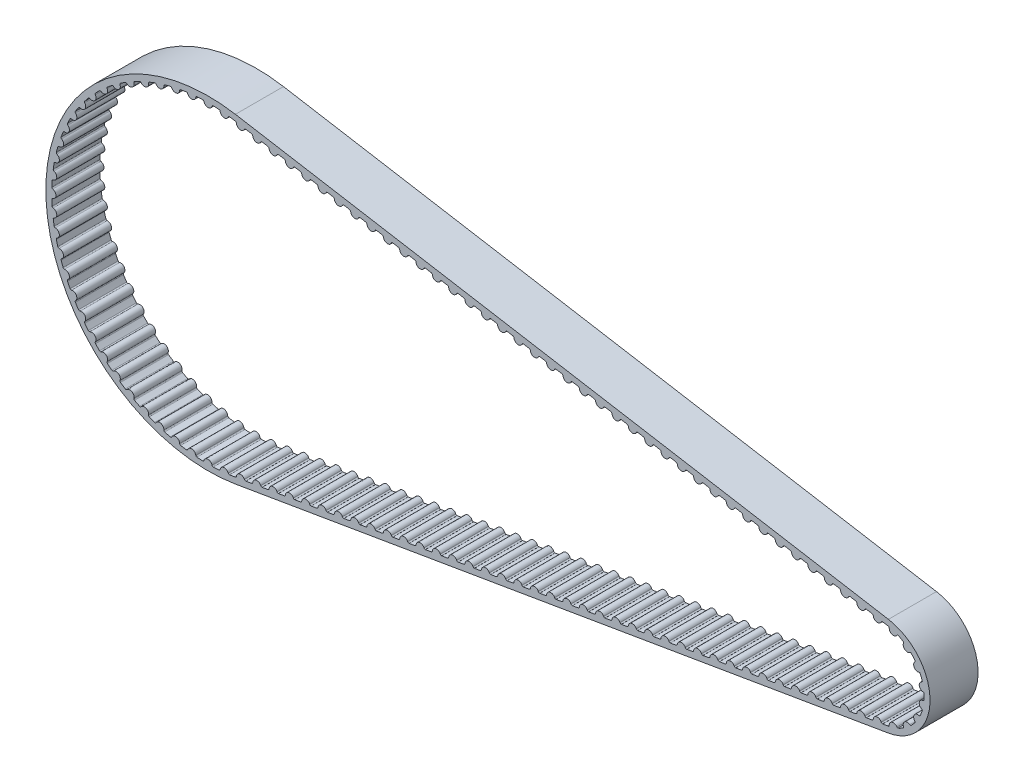
from build123d import *

# Parameters (mm, degrees)
BOSS_EXTRUDE1_DEPTH = 5
BOSS_EXTRUDE2_DEPTH = 10
CRVPATTERN1_START   = -5
CRVPATTERN1_DEPTH   = 10


with BuildPart() as part:
    # Sketch1 → Boss-Extrude1 (new, symmetric)
    with BuildSketch(Plane.XY):
        with BuildLine():
            Line((5.655497773, 33.317483845), (141.540173278, 10.251652005))
            ThreePointArc((141.540173278, 10.251652005), (150.198296585, 0), (141.540173278, -10.251652005))
            Line((141.540173278, -10.251652005), (5.655497773, -33.317483845))
            ThreePointArc((5.655497773, -33.317483845), (-33.79407322, 0), (5.655497773, 33.317483845))
        make_face()
        with BuildLine():
            Line((5.449655103, 32.104830228), (141.334330608, 9.038998388))
            ThreePointArc((141.334330608, 9.038998388), (148.968296585, 0), (141.334330608, -9.038998388))
            Line((141.334330608, -9.038998388), (5.449655103, -32.104830228))
            ThreePointArc((5.449655103, -32.104830228), (-32.56407322, 0), (5.449655103, 32.104830228))
        make_face(mode=Mode.SUBTRACT)
    extrude(amount=BOSS_EXTRUDE1_DEPTH, both=True)

    # Sketch2 → Boss-Extrude2 (add)
    with BuildSketch(Plane.XY.offset(5)):
        with BuildLine():
            Line((-32.545355766, -1.103939642), (-33.045355766, -1.103939642))
            Line((-33.045355766, -1.103939642), (-33.045355766, 1.103939642))
            Line((-33.045355766, 1.103939642), (-32.545355766, 1.103939642))
            ThreePointArc((-32.545355766, 1.103939642), (-32.493442879, 0.939042427), (-32.349600505, 0.843149723))
            ThreePointArc((-32.349600505, 0.843149723), (-31.69407322, 0), (-32.349600505, -0.843149723))
            ThreePointArc((-32.349600505, -0.843149723), (-32.493442879, -0.939042427), (-32.545355766, -1.103939642))
        make_face()
    extrude(amount=-BOSS_EXTRUDE2_DEPTH)

    # CrvPattern1: read off the stored shape, not the designer's step
    # CrvPattern1 outline → CrvPattern1 (add)
    with BuildSketch(Plane.XY.offset(CRVPATTERN1_START)):
        with BuildLine():
            ThreePointArc((-32.084703076, 4.216560542), (-32.217745732, 4.326949359), (-32.252155864, 4.496365953))
            ThreePointArc((-32.252155864, 4.496365953), (-32.386046927, 3.400416018), (-32.482707737, 2.300557044))
            ThreePointArc((-32.482707737, 2.300557044), (-32.413859707, 2.459131909), (-32.260790374, 2.539480018))
            ThreePointArc((-32.260790374, 2.539480018), (-31.520803177, 3.309568601), (-32.084703076, 4.216560542))
        make_face()
        with BuildLine():
            ThreePointArc((-31.468994451, 7.543867875), (-31.589782713, 7.667545824), (-31.606313853, 7.839629411))
            ThreePointArc((-31.606313853, 7.839629411), (-31.853914572, 6.7636522), (-32.064896766, 5.67989965))
            ThreePointArc((-32.064896766, 5.67989965), (-31.97986637, 5.830418323), (-31.819243724, 5.894343318))
            ThreePointArc((-31.819243724, 5.894343318), (-31.002887568, 6.582950683), (-31.468994451, 7.543867875))
        make_face()
        with BuildLine():
            ThreePointArc((-30.509206732, 10.788691251), (-30.616419911, 10.924306049), (-30.614891309, 11.097175082))
            ThreePointArc((-30.614891309, 11.097175082), (-30.973494442, 10.05293523), (-31.296491159, 8.997138755))
            ThreePointArc((-31.296491159, 8.997138755), (-31.196208111, 9.137955478), (-31.029788386, 9.184758409))
            ThreePointArc((-31.029788386, 9.184758409), (-30.145989235, 9.784355388), (-30.509206732, 10.788691251))
        make_face()
        with BuildLine():
            ThreePointArc((-29.215834148, 13.915552067), (-29.308299987, 14.061620914), (-29.288728356, 14.23338526))
            ThreePointArc((-29.288728356, 14.23338526), (-29.754412968, 13.232300389), (-30.185892593, 12.216003971))
            ThreePointArc((-30.185892593, 12.216003971), (-30.071453379, 12.345579067), (-29.901056192, 12.374748196))
            ThreePointArc((-29.901056192, 12.374748196), (-28.959477424, 12.878778849), (-29.215834148, 13.915552067))
        make_face()
        with BuildLine():
            ThreePointArc((-27.603018318, 16.890261515), (-27.679725802, 17.045187308), (-27.642325138, 17.213968911))
            ThreePointArc((-27.642325138, 17.213968911), (-28.209999476, 16.266984792), (-28.74524425, 15.301300522))
            ThreePointArc((-28.74524425, 15.301300522), (-28.617900138, 15.418217229), (-28.445388597, 15.429433622))
            ThreePointArc((-28.445388597, 15.429433622), (-27.456325347, 15.832386925), (-27.603018318, 16.890261515))
        make_face()
        with BuildLine():
            ThreePointArc((-25.688393621, 19.680294395), (-25.748504038, 19.842383189), (-25.693683275, 20.006336607))
            ThreePointArc((-25.693683275, 20.006336607), (-26.357140441, 19.123807477), (-26.990298047, 18.219294059))
            ThreePointArc((-26.990298047, 18.219294059), (-26.851441405, 18.32227402), (-26.678701735, 18.315415039))
            ThreePointArc((-26.678701735, 18.315415039), (-25.652968331, 18.612885137), (-25.688393621, 19.680294395))
        make_face()
        with BuildLine():
            ThreePointArc((-23.492894388, 22.255144744), (-23.535750497, 22.422624275), (-23.46410904, 22.579956856))
            ThreePointArc((-23.46410904, 22.579956856), (-24.216094854, 21.771532208), (-24.940242404, 20.938079508))
            ThreePointArc((-24.940242404, 20.938079508), (-24.791391479, 21.025996751), (-24.620312399, 21.00113739))
            ThreePointArc((-24.620312399, 21.00113739), (-23.569124115, 21.189871772), (-23.492894388, 22.255144744))
        make_face()
        with BuildLine():
            ThreePointArc((-21.040526006, 24.586659385), (-21.065659221, 24.757698447), (-20.977980393, 24.906689931))
            ThreePointArc((-20.977980393, 24.906689931), (-21.81027271, 24.181209005), (-22.617492442, 23.427929919))
            ThreePointArc((-22.617492442, 23.427929919), (-22.460274756, 23.499823164), (-22.29272683, 23.457235233))
            ThreePointArc((-22.29272683, 23.457235233), (-21.227577262, 23.535170296), (-21.040526006, 24.586659385))
        make_face()
        with BuildLine():
            ThreePointArc((-18.358102445, 26.649345751), (-18.365237963, 26.822074219), (-18.262480434, 26.961095547))
            ThreePointArc((-18.262480434, 26.961095547), (-19.165979048, 26.326490685), (-20.047444895, 25.661621497))
            ThreePointArc((-20.047444895, 25.661621497), (-19.883579452, 25.716704669), (-19.721394633, 25.656853822))
            ThreePointArc((-19.721394633, 25.656853822), (-18.653930028, 25.62313743), (-18.358102445, 26.649345751))
        make_face()
        with BuildLine():
            ThreePointArc((-15.474953078, 28.420650618), (-15.464012879, 28.593179895), (-15.347300192, 28.72071102))
            ThreePointArc((-15.347300192, 28.72071102), (-16.312126331, 28.183920934), (-17.258200427, 27.614731262))
            ThreePointArc((-17.258200427, 27.614731262), (-17.089478916, 27.652402087), (-16.934430518, 27.575942728))
            ThreePointArc((-16.934430518, 27.575942728), (-15.876322438, 27.430943533), (-15.474953078, 28.420650618))
        make_face()
        with BuildLine():
            ThreePointArc((-12.422601996, 29.881206702), (-12.3937057, 30.051650368), (-12.26431398, 30.166296877))
            ThreePointArc((-12.26431398, 30.166296877), (-13.279918324, 29.73319078), (-14.280256381, 29.265904093))
            ThreePointArc((-14.280256381, 29.265904093), (-14.108523588, 29.285750682), (-13.962306896, 29.193518809))
            ThreePointArc((-13.962306896, 29.193518809), (-12.925124596, 28.93882222), (-12.422601996, 29.881206702))
        make_face()
        with BuildLine():
            ThreePointArc((-9.234423325, 31.015044417), (-9.187886881, 31.181538857), (-9.047230885, 31.282047216))
            ThreePointArc((-9.047230885, 31.282047216), (-10.10250891, 30.95736065), (-11.146173323, 30.597086216))
            ThreePointArc((-11.146173323, 30.597086216), (-10.973306959, 30.598891568), (-10.837520693, 30.491895637))
            ThreePointArc((-10.837520693, 30.491895637), (-9.832604629, 30.130286482), (-9.234423325, 31.015044417))
        make_face()
        with BuildLine():
            ThreePointArc((-5.945276317, 31.809766485), (-5.88160855, 31.970491264), (-5.731226198, 32.055762523))
            ThreePointArc((-5.731226198, 32.055762523), (-6.814639591, 31.843045582), (-7.890219031, 31.593722609))
            ThreePointArc((-7.890219031, 31.593722609), (-7.7181092, 31.577466985), (-7.594238034, 31.456876879))
            ThreePointArc((-7.594238034, 31.456876879), (-6.632575866, 30.99230896), (-5.945276317, 31.809766485))
        make_face()
        with BuildLine():
            ThreePointArc((-2.591124204, 32.256683488), (-2.511021252, 32.409881257), (-2.352556811, 32.478983068))
            ThreePointArc((-2.352556811, 32.478983068), (-3.452259629, 32.380561579), (-4.547993808, 32.244916142))
            ThreePointArc((-4.547993808, 32.244916142), (-4.378522343, 32.210777279), (-4.267920674, 32.077911519))
            ThreePointArc((-4.267920674, 32.077911519), (-3.360027129, 31.515464378), (-2.591124204, 32.256683488))
        make_face()
        with BuildLine():
            ThreePointArc((0.791359022, 32.350908878), (0.887021322, 32.494904585), (1.051835216, 32.547081395))
            ThreePointArc((1.051835216, 32.547081395), (-0.052132976, 32.564031489), (-1.156041238, 32.543546724))
            ThreePointArc((-1.156041238, 32.543546724), (-0.991061125, 32.491897893), (-0.894938262, 32.348209221))
            ThreePointArc((-0.894938262, 32.348209221), (-0.050740163, 31.694032604), (0.791359022, 32.350908878))
        make_face()
        with BuildLine():
            ThreePointArc((4.165189602, 32.091412401), (4.275365286, 32.224631612), (4.444726574, 32.259312925))
            ThreePointArc((4.444726574, 32.259312925), (3.348563693, 32.391449271), (2.24855138, 32.486349155))
            ThreePointArc((2.24855138, 32.486349155), (2.407236264, 32.41775508), (2.487829324, 32.264814575))
            ThreePointArc((2.487829324, 32.264814575), (3.259101591, 31.526061189), (4.165189602, 32.091412401))
        make_face()
        with BuildLine():
            Line((7.817293022, 31.683948805), (7.820425421, 31.702402292))
            Line((7.820425421, 31.702402292), (5.643683307, 32.071894785))
            Line((5.643683307, 32.071894785), (5.640550908, 32.053441299))
            ThreePointArc((5.640550908, 32.053441299), (5.794434906, 31.974664686), (5.864902984, 31.816803072))
            ThreePointArc((5.864902984, 31.816803072), (6.586458329, 31.029417931), (7.527420969, 31.534597885))
            ThreePointArc((7.527420969, 31.534597885), (7.646033598, 31.660363873), (7.817293022, 31.683948805))
        make_face()
        with BuildLine():
            Line((11.215171924, 31.107173661), (11.218304323, 31.125627147))
            Line((11.218304323, 31.125627147), (9.04156221, 31.495119641))
            Line((9.04156221, 31.495119641), (9.038429811, 31.476666154))
            ThreePointArc((9.038429811, 31.476666154), (9.192313809, 31.397889541), (9.262781887, 31.240027927))
            ThreePointArc((9.262781887, 31.240027927), (9.984337232, 30.452642786), (10.925299872, 30.95782274))
            ThreePointArc((10.925299872, 30.95782274), (11.0439125, 31.083588728), (11.215171924, 31.107173661))
        make_face()
        with BuildLine():
            Line((14.613050827, 30.530398516), (14.616183226, 30.548852002))
            Line((14.616183226, 30.548852002), (12.439441112, 30.918344496))
            Line((12.439441112, 30.918344496), (12.436308713, 30.899891009))
            ThreePointArc((12.436308713, 30.899891009), (12.590192711, 30.821114397), (12.660660789, 30.663252783))
            ThreePointArc((12.660660789, 30.663252783), (13.382216134, 29.875867642), (14.323178775, 30.381047596))
            ThreePointArc((14.323178775, 30.381047596), (14.441791403, 30.506813583), (14.613050827, 30.530398516))
        make_face()
        with BuildLine():
            Line((18.01092973, 29.953623371), (18.014062129, 29.972076858))
            Line((18.014062129, 29.972076858), (15.837320015, 30.341569351))
            Line((15.837320015, 30.341569351), (15.834187616, 30.323115865))
            ThreePointArc((15.834187616, 30.323115865), (15.988071613, 30.244339252), (16.058539692, 30.086477638))
            ThreePointArc((16.058539692, 30.086477638), (16.780095037, 29.299092497), (17.721057677, 29.804272451))
            ThreePointArc((17.721057677, 29.804272451), (17.839670306, 29.930038439), (18.01092973, 29.953623371))
        make_face()
        with BuildLine():
            Line((21.408808632, 29.376848227), (21.411941031, 29.395301713))
            Line((21.411941031, 29.395301713), (19.235198917, 29.764794207))
            Line((19.235198917, 29.764794207), (19.232066519, 29.74634072))
            ThreePointArc((19.232066519, 29.74634072), (19.385950516, 29.667564107), (19.456418595, 29.509702493))
            ThreePointArc((19.456418595, 29.509702493), (20.17797394, 28.722317352), (21.11893658, 29.227497306))
            ThreePointArc((21.11893658, 29.227497306), (21.237549208, 29.353263294), (21.408808632, 29.376848227))
        make_face()
        with BuildLine():
            Line((24.806687535, 28.800073082), (24.809819934, 28.818526568))
            Line((24.809819934, 28.818526568), (22.63307782, 29.188019062))
            Line((22.63307782, 29.188019062), (22.629945421, 29.169565575))
            ThreePointArc((22.629945421, 29.169565575), (22.783829419, 29.090788963), (22.854297497, 28.932927349))
            ThreePointArc((22.854297497, 28.932927349), (23.575852842, 28.145542207), (24.516815482, 28.650722162))
            ThreePointArc((24.516815482, 28.650722162), (24.635428111, 28.776488149), (24.806687535, 28.800073082))
        make_face()
        with BuildLine():
            Line((28.204566437, 28.223297937), (28.207698836, 28.241751423))
            Line((28.207698836, 28.241751423), (26.030956723, 28.611243917))
            Line((26.030956723, 28.611243917), (26.027824324, 28.59279043))
            ThreePointArc((26.027824324, 28.59279043), (26.181708321, 28.514013818), (26.2521764, 28.356152204))
            ThreePointArc((26.2521764, 28.356152204), (26.973731745, 27.568767063), (27.914694385, 28.073947017))
            ThreePointArc((27.914694385, 28.073947017), (28.033307013, 28.199713004), (28.204566437, 28.223297937))
        make_face()
        with BuildLine():
            Line((31.60244534, 27.646522792), (31.605577739, 27.664976279))
            Line((31.605577739, 27.664976279), (29.428835625, 28.034468772))
            Line((29.428835625, 28.034468772), (29.425703226, 28.016015286))
            ThreePointArc((29.425703226, 28.016015286), (29.579587224, 27.937238673), (29.650055302, 27.779377059))
            ThreePointArc((29.650055302, 27.779377059), (30.371610647, 26.991991918), (31.312573287, 27.497171872))
            ThreePointArc((31.312573287, 27.497171872), (31.431185916, 27.62293786), (31.60244534, 27.646522792))
        make_face()
        with BuildLine():
            Line((35.000324242, 27.069747648), (35.003456641, 27.088201134))
            Line((35.003456641, 27.088201134), (32.826714528, 27.457693628))
            Line((32.826714528, 27.457693628), (32.823582129, 27.439240141))
            ThreePointArc((32.823582129, 27.439240141), (32.977466126, 27.360463529), (33.047934205, 27.202601915))
            ThreePointArc((33.047934205, 27.202601915), (33.769489549, 26.415216773), (34.71045219, 26.920396727))
            ThreePointArc((34.71045219, 26.920396727), (34.829064818, 27.046162715), (35.000324242, 27.069747648))
        make_face()
        with BuildLine():
            Line((38.398203145, 26.492972503), (38.401335544, 26.511425989))
            Line((38.401335544, 26.511425989), (36.22459343, 26.880918483))
            Line((36.22459343, 26.880918483), (36.221461031, 26.862464996))
            ThreePointArc((36.221461031, 26.862464996), (36.375345029, 26.783688384), (36.445813107, 26.62582677))
            ThreePointArc((36.445813107, 26.62582677), (37.167368452, 25.838441629), (38.108331093, 26.343621583))
            ThreePointArc((38.108331093, 26.343621583), (38.226943721, 26.46938757), (38.398203145, 26.492972503))
        make_face()
        with BuildLine():
            Line((41.796082048, 25.916197358), (41.799214447, 25.934650845))
            Line((41.799214447, 25.934650845), (39.622472333, 26.304143338))
            Line((39.622472333, 26.304143338), (39.619339934, 26.285689852))
            ThreePointArc((39.619339934, 26.285689852), (39.773223931, 26.206913239), (39.84369201, 26.049051625))
            ThreePointArc((39.84369201, 26.049051625), (40.565247355, 25.261666484), (41.506209995, 25.766846438))
            ThreePointArc((41.506209995, 25.766846438), (41.624822624, 25.892612426), (41.796082048, 25.916197358))
        make_face()
        with BuildLine():
            Line((45.19396095, 25.339422214), (45.197093349, 25.3578757))
            Line((45.197093349, 25.3578757), (43.020351236, 25.727368193))
            Line((43.020351236, 25.727368193), (43.017218837, 25.708914707))
            ThreePointArc((43.017218837, 25.708914707), (43.171102835, 25.630138094), (43.241570913, 25.47227648))
            ThreePointArc((43.241570913, 25.47227648), (43.963126258, 24.684891339), (44.904088898, 25.190071293))
            ThreePointArc((44.904088898, 25.190071293), (45.022701526, 25.315837281), (45.19396095, 25.339422214))
        make_face()
        with BuildLine():
            Line((48.591839853, 24.762647069), (48.594972252, 24.781100555))
            Line((48.594972252, 24.781100555), (46.418230138, 25.150593049))
            Line((46.418230138, 25.150593049), (46.415097739, 25.132139562))
            ThreePointArc((46.415097739, 25.132139562), (46.568981737, 25.05336295), (46.639449815, 24.895501336))
            ThreePointArc((46.639449815, 24.895501336), (47.36100516, 24.108116194), (48.3019678, 24.613296149))
            ThreePointArc((48.3019678, 24.613296149), (48.420580429, 24.739062136), (48.591839853, 24.762647069))
        make_face()
        with BuildLine():
            Line((51.989718755, 24.185871924), (51.992851154, 24.20432541))
            Line((51.992851154, 24.20432541), (49.816109041, 24.573817904))
            Line((49.816109041, 24.573817904), (49.812976642, 24.555364417))
            ThreePointArc((49.812976642, 24.555364417), (49.966860639, 24.476587805), (50.037328718, 24.318726191))
            ThreePointArc((50.037328718, 24.318726191), (50.758884063, 23.53134105), (51.699846703, 24.036521004))
            ThreePointArc((51.699846703, 24.036521004), (51.818459331, 24.162286991), (51.989718755, 24.185871924))
        make_face()
        with BuildLine():
            Line((55.387597658, 23.609096779), (55.390730057, 23.627550266))
            Line((55.390730057, 23.627550266), (53.213987943, 23.997042759))
            Line((53.213987943, 23.997042759), (53.210855544, 23.978589273))
            ThreePointArc((53.210855544, 23.978589273), (53.364739542, 23.89981266), (53.43520762, 23.741951046))
            ThreePointArc((53.43520762, 23.741951046), (54.156762965, 22.954565905), (55.097725605, 23.459745859))
            ThreePointArc((55.097725605, 23.459745859), (55.216338234, 23.585511847), (55.387597658, 23.609096779))
        make_face()
        with BuildLine():
            Line((58.785476561, 23.032321635), (58.788608959, 23.050775121))
            Line((58.788608959, 23.050775121), (56.611866846, 23.420267615))
            Line((56.611866846, 23.420267615), (56.608734447, 23.401814128))
            ThreePointArc((56.608734447, 23.401814128), (56.762618444, 23.323037516), (56.833086523, 23.165175902))
            ThreePointArc((56.833086523, 23.165175902), (57.554641867, 22.37779076), (58.495604508, 22.882970714))
            ThreePointArc((58.495604508, 22.882970714), (58.614217137, 23.008736702), (58.785476561, 23.032321635))
        make_face()
        with BuildLine():
            Line((62.183355463, 22.45554649), (62.186487862, 22.473999976))
            Line((62.186487862, 22.473999976), (60.009745748, 22.84349247))
            Line((60.009745748, 22.84349247), (60.006613349, 22.825038983))
            ThreePointArc((60.006613349, 22.825038983), (60.160497347, 22.746262371), (60.230965425, 22.588400757))
            ThreePointArc((60.230965425, 22.588400757), (60.95252077, 21.801015616), (61.893483411, 22.30619557))
            ThreePointArc((61.893483411, 22.30619557), (62.012096039, 22.431961557), (62.183355463, 22.45554649))
        make_face()
        with BuildLine():
            Line((65.581234366, 21.878771345), (65.584366765, 21.897224832))
            Line((65.584366765, 21.897224832), (63.407624651, 22.266717325))
            Line((63.407624651, 22.266717325), (63.404492252, 22.248263839))
            ThreePointArc((63.404492252, 22.248263839), (63.55837625, 22.169487226), (63.628844328, 22.011625612))
            ThreePointArc((63.628844328, 22.011625612), (64.350399673, 21.224240471), (65.291362313, 21.729420425))
            ThreePointArc((65.291362313, 21.729420425), (65.409974942, 21.855186413), (65.581234366, 21.878771345))
        make_face()
        with BuildLine():
            Line((68.979113268, 21.301996201), (68.982245667, 21.320449687))
            Line((68.982245667, 21.320449687), (66.805503554, 21.68994218))
            Line((66.805503554, 21.68994218), (66.802371155, 21.671488694))
            ThreePointArc((66.802371155, 21.671488694), (66.956255153, 21.592712081), (67.026723231, 21.434850467))
            ThreePointArc((67.026723231, 21.434850467), (67.748278576, 20.647465326), (68.689241216, 21.15264528))
            ThreePointArc((68.689241216, 21.15264528), (68.807853844, 21.278411268), (68.979113268, 21.301996201))
        make_face()
        with BuildLine():
            Line((72.376992171, 20.725221056), (72.38012457, 20.743674542))
            Line((72.38012457, 20.743674542), (70.203382456, 21.113167036))
            Line((70.203382456, 21.113167036), (70.200250057, 21.094713549))
            ThreePointArc((70.200250057, 21.094713549), (70.354134055, 21.015936937), (70.424602133, 20.858075323))
            ThreePointArc((70.424602133, 20.858075323), (71.146157478, 20.070690182), (72.087120118, 20.575870136))
            ThreePointArc((72.087120118, 20.575870136), (72.205732747, 20.701636123), (72.376992171, 20.725221056))
        make_face()
        with BuildLine():
            Line((75.774871073, 20.148445911), (75.778003472, 20.166899397))
            Line((75.778003472, 20.166899397), (73.601261359, 20.536391891))
            Line((73.601261359, 20.536391891), (73.59812896, 20.517938404))
            ThreePointArc((73.59812896, 20.517938404), (73.752012957, 20.439161792), (73.822481036, 20.281300178))
            ThreePointArc((73.822481036, 20.281300178), (74.544036381, 19.493915037), (75.484999021, 19.999094991))
            ThreePointArc((75.484999021, 19.999094991), (75.603611649, 20.124860979), (75.774871073, 20.148445911))
        make_face()
        with BuildLine():
            Line((79.172749976, 19.571670766), (79.175882375, 19.590124253))
            Line((79.175882375, 19.590124253), (76.999140261, 19.959616746))
            Line((76.999140261, 19.959616746), (76.996007862, 19.94116326))
            ThreePointArc((76.996007862, 19.94116326), (77.14989186, 19.862386647), (77.220359938, 19.704525033))
            ThreePointArc((77.220359938, 19.704525033), (77.941915283, 18.917139892), (78.882877923, 19.422319846))
            ThreePointArc((78.882877923, 19.422319846), (79.001490552, 19.548085834), (79.172749976, 19.571670766))
        make_face()
        with BuildLine():
            Line((82.570628879, 18.994895622), (82.573761277, 19.013349108))
            Line((82.573761277, 19.013349108), (80.397019164, 19.382841602))
            Line((80.397019164, 19.382841602), (80.393886765, 19.364388115))
            ThreePointArc((80.393886765, 19.364388115), (80.547770762, 19.285611503), (80.618238841, 19.127749889))
            ThreePointArc((80.618238841, 19.127749889), (81.339794185, 18.340364747), (82.280756826, 18.845544701))
            ThreePointArc((82.280756826, 18.845544701), (82.399369455, 18.971310689), (82.570628879, 18.994895622))
        make_face()
        with BuildLine():
            Line((85.968507781, 18.418120477), (85.97164018, 18.436573963))
            Line((85.97164018, 18.436573963), (83.794898066, 18.806066457))
            Line((83.794898066, 18.806066457), (83.791765668, 18.78761297))
            ThreePointArc((83.791765668, 18.78761297), (83.945649665, 18.708836358), (84.016117743, 18.550974744))
            ThreePointArc((84.016117743, 18.550974744), (84.737673088, 17.763589603), (85.678635729, 18.268769557))
            ThreePointArc((85.678635729, 18.268769557), (85.797248357, 18.394535544), (85.968507781, 18.418120477))
        make_face()
        with BuildLine():
            Line((89.366386684, 17.841345332), (89.369519083, 17.859798819))
            Line((89.369519083, 17.859798819), (87.192776969, 18.229291312))
            Line((87.192776969, 18.229291312), (87.18964457, 18.210837826))
            ThreePointArc((87.18964457, 18.210837826), (87.343528568, 18.132061213), (87.413996646, 17.974199599))
            ThreePointArc((87.413996646, 17.974199599), (88.135551991, 17.186814458), (89.076514631, 17.691994412))
            ThreePointArc((89.076514631, 17.691994412), (89.19512726, 17.8177604), (89.366386684, 17.841345332))
        make_face()
        with BuildLine():
            Line((92.764265586, 17.264570188), (92.767397985, 17.283023674))
            Line((92.767397985, 17.283023674), (90.590655872, 17.652516167))
            Line((90.590655872, 17.652516167), (90.587523473, 17.634062681))
            ThreePointArc((90.587523473, 17.634062681), (90.741407471, 17.555286068), (90.811875549, 17.397424454))
            ThreePointArc((90.811875549, 17.397424454), (91.533430894, 16.610039313), (92.474393534, 17.115219267))
            ThreePointArc((92.474393534, 17.115219267), (92.593006162, 17.240985255), (92.764265586, 17.264570188))
        make_face()
        with BuildLine():
            Line((96.162144489, 16.687795043), (96.165276888, 16.706248529))
            Line((96.165276888, 16.706248529), (93.988534774, 17.075741023))
            Line((93.988534774, 17.075741023), (93.985402375, 17.057287536))
            ThreePointArc((93.985402375, 17.057287536), (94.139286373, 16.978510924), (94.209754451, 16.82064931))
            ThreePointArc((94.209754451, 16.82064931), (94.931309796, 16.033264169), (95.872272436, 16.538444123))
            ThreePointArc((95.872272436, 16.538444123), (95.990885065, 16.66421011), (96.162144489, 16.687795043))
        make_face()
        with BuildLine():
            Line((99.560023391, 16.111019898), (99.56315579, 16.129473384))
            Line((99.56315579, 16.129473384), (97.386413677, 16.498965878))
            Line((97.386413677, 16.498965878), (97.383281278, 16.480512391))
            ThreePointArc((97.383281278, 16.480512391), (97.537165275, 16.401735779), (97.607633354, 16.243874165))
            ThreePointArc((97.607633354, 16.243874165), (98.329188699, 15.456489024), (99.270151339, 15.961668978))
            ThreePointArc((99.270151339, 15.961668978), (99.388763967, 16.087434966), (99.560023391, 16.111019898))
        make_face()
        with BuildLine():
            Line((102.957902294, 15.534244753), (102.961034693, 15.55269824))
            Line((102.961034693, 15.55269824), (100.784292579, 15.922190733))
            Line((100.784292579, 15.922190733), (100.78116018, 15.903737247))
            ThreePointArc((100.78116018, 15.903737247), (100.935044178, 15.824960634), (101.005512256, 15.66709902))
            ThreePointArc((101.005512256, 15.66709902), (101.727067601, 14.879713879), (102.668030241, 15.384893833))
            ThreePointArc((102.668030241, 15.384893833), (102.78664287, 15.510659821), (102.957902294, 15.534244753))
        make_face()
        with BuildLine():
            Line((106.355781197, 14.957469609), (106.358913595, 14.975923095))
            Line((106.358913595, 14.975923095), (104.182171482, 15.345415589))
            Line((104.182171482, 15.345415589), (104.179039083, 15.326962102))
            ThreePointArc((104.179039083, 15.326962102), (104.33292308, 15.24818549), (104.403391159, 15.090323876))
            ThreePointArc((104.403391159, 15.090323876), (105.124946503, 14.302938734), (106.065909144, 14.808118688))
            ThreePointArc((106.065909144, 14.808118688), (106.184521773, 14.933884676), (106.355781197, 14.957469609))
        make_face()
        with BuildLine():
            Line((109.753660099, 14.380694464), (109.756792498, 14.39914795))
            Line((109.756792498, 14.39914795), (107.580050384, 14.768640444))
            Line((107.580050384, 14.768640444), (107.576917986, 14.750186957))
            ThreePointArc((107.576917986, 14.750186957), (107.730801983, 14.671410345), (107.801270062, 14.513548731))
            ThreePointArc((107.801270062, 14.513548731), (108.522825407, 13.72616359), (109.463788047, 14.231343544))
            ThreePointArc((109.463788047, 14.231343544), (109.582400675, 14.357109531), (109.753660099, 14.380694464))
        make_face()
        with BuildLine():
            Line((113.151539002, 13.803919319), (113.154671401, 13.822372806))
            Line((113.154671401, 13.822372806), (110.977929287, 14.191865299))
            Line((110.977929287, 14.191865299), (110.974796888, 14.173411813))
            ThreePointArc((110.974796888, 14.173411813), (111.128680886, 14.0946352), (111.199148964, 13.936773586))
            ThreePointArc((111.199148964, 13.936773586), (111.920704309, 13.149388445), (112.861666949, 13.654568399))
            ThreePointArc((112.861666949, 13.654568399), (112.980279578, 13.780334387), (113.151539002, 13.803919319))
        make_face()
        with BuildLine():
            Line((116.549417904, 13.227144175), (116.552550303, 13.245597661))
            Line((116.552550303, 13.245597661), (114.37580819, 13.615090154))
            Line((114.37580819, 13.615090154), (114.372675791, 13.596636668))
            ThreePointArc((114.372675791, 13.596636668), (114.526559789, 13.517860055), (114.597027867, 13.359998441))
            ThreePointArc((114.597027867, 13.359998441), (115.318583212, 12.5726133), (116.259545852, 13.077793254))
            ThreePointArc((116.259545852, 13.077793254), (116.37815848, 13.203559242), (116.549417904, 13.227144175))
        make_face()
        with BuildLine():
            Line((119.947296807, 12.65036903), (119.950429206, 12.668822516))
            Line((119.950429206, 12.668822516), (117.773687092, 13.03831501))
            Line((117.773687092, 13.03831501), (117.770554693, 13.019861523))
            ThreePointArc((117.770554693, 13.019861523), (117.924438691, 12.941084911), (117.994906769, 12.783223297))
            ThreePointArc((117.994906769, 12.783223297), (118.716462114, 11.995838156), (119.657424754, 12.50101811))
            ThreePointArc((119.657424754, 12.50101811), (119.776037383, 12.626784097), (119.947296807, 12.65036903))
        make_face()
        with BuildLine():
            Line((123.345175709, 12.073593885), (123.348308108, 12.092047371))
            Line((123.348308108, 12.092047371), (121.171565995, 12.461539865))
            Line((121.171565995, 12.461539865), (121.168433596, 12.443086379))
            ThreePointArc((121.168433596, 12.443086379), (121.322317593, 12.364309766), (121.392785672, 12.206448152))
            ThreePointArc((121.392785672, 12.206448152), (122.114341017, 11.419063011), (123.055303657, 11.924242965))
            ThreePointArc((123.055303657, 11.924242965), (123.173916285, 12.050008953), (123.345175709, 12.073593885))
        make_face()
        with BuildLine():
            Line((126.743054612, 11.496818741), (126.746187011, 11.515272227))
            Line((126.746187011, 11.515272227), (124.569444897, 11.88476472))
            Line((124.569444897, 11.88476472), (124.566312498, 11.866311234))
            ThreePointArc((124.566312498, 11.866311234), (124.720196496, 11.787534621), (124.790664574, 11.629673007))
            ThreePointArc((124.790664574, 11.629673007), (125.512219919, 10.842287866), (126.45318256, 11.34746782))
            ThreePointArc((126.45318256, 11.34746782), (126.571795188, 11.473233808), (126.743054612, 11.496818741))
        make_face()
        with BuildLine():
            Line((130.140933515, 10.920043596), (130.144065914, 10.938497082))
            Line((130.144065914, 10.938497082), (127.9673238, 11.307989575))
            Line((127.9673238, 11.307989575), (127.964191401, 11.289536089))
            ThreePointArc((127.964191401, 11.289536089), (128.118075398, 11.210759477), (128.188543477, 11.052897863))
            ThreePointArc((128.188543477, 11.052897863), (128.910098822, 10.265512721), (129.851061462, 10.770692676))
            ThreePointArc((129.851061462, 10.770692676), (129.969674091, 10.896458663), (130.140933515, 10.920043596))
        make_face()
        with BuildLine():
            Line((133.538812417, 10.343268451), (133.541944816, 10.361721937))
            Line((133.541944816, 10.361721937), (131.365202703, 10.731214431))
            Line((131.365202703, 10.731214431), (131.362070304, 10.712760944))
            ThreePointArc((131.362070304, 10.712760944), (131.515954301, 10.633984332), (131.58642238, 10.476122718))
            ThreePointArc((131.58642238, 10.476122718), (132.307977725, 9.688737577), (133.248940365, 10.193917531))
            ThreePointArc((133.248940365, 10.193917531), (133.367552993, 10.319683518), (133.538812417, 10.343268451))
        make_face()
        with BuildLine():
            Line((136.93669132, 9.766493306), (136.939823719, 9.784946793))
            Line((136.939823719, 9.784946793), (134.763081605, 10.154439286))
            Line((134.763081605, 10.154439286), (134.759949206, 10.1359858))
            ThreePointArc((134.759949206, 10.1359858), (134.913833204, 10.057209187), (134.984301282, 9.899347573))
            ThreePointArc((134.984301282, 9.899347573), (135.705856627, 9.111962432), (136.646819267, 9.617142386))
            ThreePointArc((136.646819267, 9.617142386), (136.765431896, 9.742908374), (136.93669132, 9.766493306))
        make_face()
        with BuildLine():
            Line((140.334570222, 9.189718162), (140.337702621, 9.208171648))
            Line((140.337702621, 9.208171648), (138.160960508, 9.577664141))
            Line((138.160960508, 9.577664141), (138.157828109, 9.559210655))
            ThreePointArc((138.157828109, 9.559210655), (138.311712106, 9.480434043), (138.382180185, 9.322572429))
            ThreePointArc((138.382180185, 9.322572429), (139.103735529, 8.535187287), (140.04469817, 9.040367241))
            ThreePointArc((140.04469817, 9.040367241), (140.163310798, 9.166133229), (140.334570222, 9.189718162))
        make_face()
        with BuildLine():
            ThreePointArc((143.314494003, 8.27829664), (143.386938037, 8.354478553), (143.483627299, 8.395746077))
            ThreePointArc((143.483627299, 8.395746077), (142.575852853, 8.737980499), (141.636997672, 8.982377293))
            ThreePointArc((141.636997672, 8.982377293), (141.692144411, 8.892875008), (141.707341406, 8.788851581))
            ThreePointArc((141.707341406, 8.788851581), (142.312446018, 7.908814147), (143.314494003, 8.27829664))
        make_face()
        with BuildLine():
            ThreePointArc((146.011387639, 6.503885527), (146.10606655, 6.549577165), (146.211099338, 6.554042077))
            ThreePointArc((146.211099338, 6.554042077), (145.482662428, 7.194790477), (144.690597746, 7.754980074))
            ThreePointArc((144.690597746, 7.754980074), (144.710585634, 7.651770063), (144.688069717, 7.549081917))
            ThreePointArc((144.688069717, 7.549081917), (144.943421984, 6.512060849), (146.011387639, 6.503885527))
        make_face()
        with BuildLine():
            ThreePointArc((147.907933074, 3.891437346), (148.012647318, 3.900751261), (148.112489972, 3.86783825))
            ThreePointArc((148.112489972, 3.86783825), (147.657250972, 4.724539071), (147.114035716, 5.52834006))
            ThreePointArc((147.114035716, 5.52834006), (147.096289276, 5.424721115), (147.038961664, 5.336599796))
            ThreePointArc((147.038961664, 5.336599796), (146.911658998, 4.276217078), (147.907933074, 3.891437346))
        make_face()
        with BuildLine():
            ThreePointArc((148.759757099, 0.777570632), (148.861014062, 0.74930671), (148.942801682, 0.683256674))
            ThreePointArc((148.942801682, 0.683256674), (148.819418935, 1.645522512), (148.595047344, 2.589363724))
            ThreePointArc((148.595047344, 2.589363724), (148.541853237, 2.498687327), (148.457100692, 2.436487423))
            ThreePointArc((148.457100692, 2.436487423), (147.963546266, 1.48937523), (148.759757099, 0.777570632))
        make_face()
        with BuildLine():
            ThreePointArc((148.457100692, -2.436487423), (148.541853237, -2.498687327), (148.595047344, -2.589363724))
            ThreePointArc((148.595047344, -2.589363724), (148.819418935, -1.645522512), (148.942801682, -0.683256674))
            ThreePointArc((148.942801682, -0.683256674), (148.861014062, -0.74930671), (148.759757099, -0.777570632))
            ThreePointArc((148.759757099, -0.777570632), (147.963546266, -1.48937523), (148.457100692, -2.436487423))
        make_face()
        with BuildLine():
            ThreePointArc((147.038961664, -5.336599796), (147.096289276, -5.424721115), (147.114035716, -5.52834006))
            ThreePointArc((147.114035716, -5.52834006), (147.657250972, -4.724539071), (148.112489972, -3.86783825))
            ThreePointArc((148.112489972, -3.86783825), (148.012647318, -3.900751261), (147.907933074, -3.891437346))
            ThreePointArc((147.907933074, -3.891437346), (146.911658998, -4.276217078), (147.038961664, -5.336599796))
        make_face()
        with BuildLine():
            ThreePointArc((144.688069717, -7.549081917), (144.710585634, -7.651770063), (144.690597746, -7.754980074))
            ThreePointArc((144.690597746, -7.754980074), (145.482662428, -7.194790477), (146.211099338, -6.554042077))
            ThreePointArc((146.211099338, -6.554042077), (146.10606655, -6.549577165), (146.011387639, -6.503885527))
            ThreePointArc((146.011387639, -6.503885527), (144.943421984, -6.512060849), (144.688069717, -7.549081917))
        make_face()
        with BuildLine():
            ThreePointArc((141.707341406, -8.788851581), (141.692144411, -8.892875008), (141.636997672, -8.982377293))
            ThreePointArc((141.636997672, -8.982377293), (142.575852853, -8.737980499), (143.483627299, -8.395746077))
            ThreePointArc((143.483627299, -8.395746077), (143.386938037, -8.354478553), (143.314494003, -8.27829664))
            ThreePointArc((143.314494003, -8.27829664), (142.312446018, -7.908814147), (141.707341406, -8.788851581))
        make_face()
        with BuildLine():
            Line((138.157828109, -9.559210655), (138.160960508, -9.577664141))
            Line((138.160960508, -9.577664141), (140.337702621, -9.208171648))
            Line((140.337702621, -9.208171648), (140.334570222, -9.189718162))
            ThreePointArc((140.334570222, -9.189718162), (140.163310798, -9.166133229), (140.04469817, -9.040367241))
            ThreePointArc((140.04469817, -9.040367241), (139.103735529, -8.535187287), (138.382180185, -9.322572429))
            ThreePointArc((138.382180185, -9.322572429), (138.311712106, -9.480434043), (138.157828109, -9.559210655))
        make_face()
        with BuildLine():
            Line((134.759949206, -10.1359858), (134.763081605, -10.154439286))
            Line((134.763081605, -10.154439286), (136.939823719, -9.784946793))
            Line((136.939823719, -9.784946793), (136.93669132, -9.766493306))
            ThreePointArc((136.93669132, -9.766493306), (136.765431896, -9.742908374), (136.646819267, -9.617142386))
            ThreePointArc((136.646819267, -9.617142386), (135.705856627, -9.111962432), (134.984301282, -9.899347573))
            ThreePointArc((134.984301282, -9.899347573), (134.913833204, -10.057209187), (134.759949206, -10.1359858))
        make_face()
        with BuildLine():
            Line((131.362070304, -10.712760944), (131.365202703, -10.731214431))
            Line((131.365202703, -10.731214431), (133.541944816, -10.361721938))
            Line((133.541944816, -10.361721938), (133.538812417, -10.343268451))
            ThreePointArc((133.538812417, -10.343268451), (133.367552993, -10.319683518), (133.248940365, -10.193917531))
            ThreePointArc((133.248940365, -10.193917531), (132.307977725, -9.688737577), (131.58642238, -10.476122718))
            ThreePointArc((131.58642238, -10.476122718), (131.515954301, -10.633984332), (131.362070304, -10.712760944))
        make_face()
        with BuildLine():
            Line((127.964191401, -11.289536089), (127.9673238, -11.307989575))
            Line((127.9673238, -11.307989575), (130.144065914, -10.938497082))
            Line((130.144065914, -10.938497082), (130.140933515, -10.920043596))
            ThreePointArc((130.140933515, -10.920043596), (129.969674091, -10.896458663), (129.851061462, -10.770692676))
            ThreePointArc((129.851061462, -10.770692676), (128.910098822, -10.265512721), (128.188543477, -11.052897863))
            ThreePointArc((128.188543477, -11.052897863), (128.118075398, -11.210759477), (127.964191401, -11.289536089))
        make_face()
        with BuildLine():
            Line((124.566312498, -11.866311234), (124.569444897, -11.88476472))
            Line((124.569444897, -11.88476472), (126.746187011, -11.515272227))
            Line((126.746187011, -11.515272227), (126.743054612, -11.496818741))
            ThreePointArc((126.743054612, -11.496818741), (126.571795188, -11.473233808), (126.45318256, -11.34746782))
            ThreePointArc((126.45318256, -11.34746782), (125.512219919, -10.842287866), (124.790664574, -11.629673007))
            ThreePointArc((124.790664574, -11.629673007), (124.720196496, -11.787534621), (124.566312498, -11.866311234))
        make_face()
        with BuildLine():
            Line((121.168433596, -12.443086379), (121.171565995, -12.461539865))
            Line((121.171565995, -12.461539865), (123.348308108, -12.092047372))
            Line((123.348308108, -12.092047372), (123.345175709, -12.073593885))
            ThreePointArc((123.345175709, -12.073593885), (123.173916285, -12.050008953), (123.055303657, -11.924242965))
            ThreePointArc((123.055303657, -11.924242965), (122.114341017, -11.419063011), (121.392785672, -12.206448152))
            ThreePointArc((121.392785672, -12.206448152), (121.322317593, -12.364309766), (121.168433596, -12.443086379))
        make_face()
        with BuildLine():
            Line((117.770554693, -13.019861523), (117.773687092, -13.038315009))
            Line((117.773687092, -13.038315009), (119.950429206, -12.668822516))
            Line((119.950429206, -12.668822516), (119.947296807, -12.65036903))
            ThreePointArc((119.947296807, -12.65036903), (119.776037383, -12.626784097), (119.657424754, -12.50101811))
            ThreePointArc((119.657424754, -12.50101811), (118.716462114, -11.995838156), (117.994906769, -12.783223297))
            ThreePointArc((117.994906769, -12.783223297), (117.924438691, -12.941084911), (117.770554693, -13.019861523))
        make_face()
        with BuildLine():
            Line((114.372675791, -13.596636668), (114.37580819, -13.615090154))
            Line((114.37580819, -13.615090154), (116.552550303, -13.245597661))
            Line((116.552550303, -13.245597661), (116.549417904, -13.227144175))
            ThreePointArc((116.549417904, -13.227144175), (116.37815848, -13.203559242), (116.259545852, -13.077793254))
            ThreePointArc((116.259545852, -13.077793254), (115.318583212, -12.5726133), (114.597027867, -13.359998441))
            ThreePointArc((114.597027867, -13.359998441), (114.526559789, -13.517860055), (114.372675791, -13.596636668))
        make_face()
        with BuildLine():
            Line((110.974796888, -14.173411813), (110.977929287, -14.191865299))
            Line((110.977929287, -14.191865299), (113.154671401, -13.822372806))
            Line((113.154671401, -13.822372806), (113.151539002, -13.803919319))
            ThreePointArc((113.151539002, -13.803919319), (112.980279578, -13.780334387), (112.861666949, -13.654568399))
            ThreePointArc((112.861666949, -13.654568399), (111.920704309, -13.149388445), (111.199148964, -13.936773586))
            ThreePointArc((111.199148964, -13.936773586), (111.128680886, -14.0946352), (110.974796888, -14.173411813))
        make_face()
        with BuildLine():
            Line((107.576917986, -14.750186957), (107.580050384, -14.768640444))
            Line((107.580050384, -14.768640444), (109.756792498, -14.399147951))
            Line((109.756792498, -14.399147951), (109.753660099, -14.380694464))
            ThreePointArc((109.753660099, -14.380694464), (109.582400675, -14.357109531), (109.463788047, -14.231343544))
            ThreePointArc((109.463788047, -14.231343544), (108.522825407, -13.72616359), (107.801270062, -14.513548731))
            ThreePointArc((107.801270062, -14.513548731), (107.730801983, -14.671410345), (107.576917986, -14.750186957))
        make_face()
        with BuildLine():
            Line((104.179039083, -15.326962102), (104.182171482, -15.345415588))
            Line((104.182171482, -15.345415588), (106.358913595, -14.975923095))
            Line((106.358913595, -14.975923095), (106.355781197, -14.957469609))
            ThreePointArc((106.355781197, -14.957469609), (106.184521773, -14.933884676), (106.065909144, -14.808118688))
            ThreePointArc((106.065909144, -14.808118688), (105.124946503, -14.302938734), (104.403391159, -15.090323876))
            ThreePointArc((104.403391159, -15.090323876), (104.33292308, -15.24818549), (104.179039083, -15.326962102))
        make_face()
        with BuildLine():
            Line((100.78116018, -15.903737247), (100.784292579, -15.922190733))
            Line((100.784292579, -15.922190733), (102.961034693, -15.55269824))
            Line((102.961034693, -15.55269824), (102.957902294, -15.534244753))
            ThreePointArc((102.957902294, -15.534244753), (102.78664287, -15.510659821), (102.668030241, -15.384893833))
            ThreePointArc((102.668030241, -15.384893833), (101.727067601, -14.879713879), (101.005512256, -15.66709902))
            ThreePointArc((101.005512256, -15.66709902), (100.935044178, -15.824960634), (100.78116018, -15.903737247))
        make_face()
        with BuildLine():
            Line((97.383281278, -16.480512391), (97.386413677, -16.498965878))
            Line((97.386413677, -16.498965878), (99.56315579, -16.129473385))
            Line((99.56315579, -16.129473385), (99.560023391, -16.111019898))
            ThreePointArc((99.560023391, -16.111019898), (99.388763967, -16.087434966), (99.270151339, -15.961668978))
            ThreePointArc((99.270151339, -15.961668978), (98.329188699, -15.456489024), (97.607633354, -16.243874165))
            ThreePointArc((97.607633354, -16.243874165), (97.537165275, -16.401735779), (97.383281278, -16.480512391))
        make_face()
        with BuildLine():
            Line((93.985402375, -17.057287536), (93.988534774, -17.075741022))
            Line((93.988534774, -17.075741022), (96.165276888, -16.706248529))
            Line((96.165276888, -16.706248529), (96.162144489, -16.687795043))
            ThreePointArc((96.162144489, -16.687795043), (95.990885065, -16.66421011), (95.872272436, -16.538444123))
            ThreePointArc((95.872272436, -16.538444123), (94.931309796, -16.033264169), (94.209754451, -16.82064931))
            ThreePointArc((94.209754451, -16.82064931), (94.139286373, -16.978510924), (93.985402375, -17.057287536))
        make_face()
        with BuildLine():
            Line((90.587523473, -17.634062681), (90.590655872, -17.652516167))
            Line((90.590655872, -17.652516167), (92.767397985, -17.283023674))
            Line((92.767397985, -17.283023674), (92.764265586, -17.264570188))
            ThreePointArc((92.764265586, -17.264570188), (92.593006162, -17.240985255), (92.474393534, -17.115219267))
            ThreePointArc((92.474393534, -17.115219267), (91.533430894, -16.610039313), (90.811875549, -17.397424454))
            ThreePointArc((90.811875549, -17.397424454), (90.741407471, -17.555286068), (90.587523473, -17.634062681))
        make_face()
        with BuildLine():
            Line((87.18964457, -18.210837826), (87.192776969, -18.229291312))
            Line((87.192776969, -18.229291312), (89.369519083, -17.859798819))
            Line((89.369519083, -17.859798819), (89.366386684, -17.841345332))
            ThreePointArc((89.366386684, -17.841345332), (89.19512726, -17.8177604), (89.076514631, -17.691994412))
            ThreePointArc((89.076514631, -17.691994412), (88.135551991, -17.186814458), (87.413996646, -17.974199599))
            ThreePointArc((87.413996646, -17.974199599), (87.343528568, -18.132061213), (87.18964457, -18.210837826))
        make_face()
        with BuildLine():
            Line((83.791765668, -18.78761297), (83.794898066, -18.806066457))
            Line((83.794898066, -18.806066457), (85.97164018, -18.436573964))
            Line((85.97164018, -18.436573964), (85.968507781, -18.418120477))
            ThreePointArc((85.968507781, -18.418120477), (85.797248357, -18.394535544), (85.678635729, -18.268769557))
            ThreePointArc((85.678635729, -18.268769557), (84.737673088, -17.763589603), (84.016117743, -18.550974744))
            ThreePointArc((84.016117743, -18.550974744), (83.945649665, -18.708836358), (83.791765668, -18.78761297))
        make_face()
        with BuildLine():
            Line((80.393886765, -19.364388115), (80.397019164, -19.382841601))
            Line((80.397019164, -19.382841601), (82.573761277, -19.013349108))
            Line((82.573761277, -19.013349108), (82.570628879, -18.994895622))
            ThreePointArc((82.570628879, -18.994895622), (82.399369455, -18.971310689), (82.280756826, -18.845544701))
            ThreePointArc((82.280756826, -18.845544701), (81.339794185, -18.340364747), (80.618238841, -19.127749889))
            ThreePointArc((80.618238841, -19.127749889), (80.547770762, -19.285611503), (80.393886765, -19.364388115))
        make_face()
        with BuildLine():
            Line((76.996007862, -19.94116326), (76.999140261, -19.959616746))
            Line((76.999140261, -19.959616746), (79.175882375, -19.590124253))
            Line((79.175882375, -19.590124253), (79.172749976, -19.571670766))
            ThreePointArc((79.172749976, -19.571670766), (79.001490552, -19.548085834), (78.882877923, -19.422319846))
            ThreePointArc((78.882877923, -19.422319846), (77.941915283, -18.917139892), (77.220359938, -19.704525033))
            ThreePointArc((77.220359938, -19.704525033), (77.14989186, -19.862386647), (76.996007862, -19.94116326))
        make_face()
        with BuildLine():
            Line((73.59812896, -20.517938404), (73.601261359, -20.536391891))
            Line((73.601261359, -20.536391891), (75.778003472, -20.166899398))
            Line((75.778003472, -20.166899398), (75.774871073, -20.148445911))
            ThreePointArc((75.774871073, -20.148445911), (75.603611649, -20.124860979), (75.484999021, -19.999094991))
            ThreePointArc((75.484999021, -19.999094991), (74.544036381, -19.493915037), (73.822481036, -20.281300178))
            ThreePointArc((73.822481036, -20.281300178), (73.752012957, -20.439161792), (73.59812896, -20.517938404))
        make_face()
        with BuildLine():
            Line((70.200250057, -21.094713549), (70.203382456, -21.113167035))
            Line((70.203382456, -21.113167035), (72.38012457, -20.743674542))
            Line((72.38012457, -20.743674542), (72.376992171, -20.725221056))
            ThreePointArc((72.376992171, -20.725221056), (72.205732747, -20.701636123), (72.087120118, -20.575870136))
            ThreePointArc((72.087120118, -20.575870136), (71.146157478, -20.070690182), (70.424602133, -20.858075323))
            ThreePointArc((70.424602133, -20.858075323), (70.354134055, -21.015936937), (70.200250057, -21.094713549))
        make_face()
        with BuildLine():
            Line((66.802371155, -21.671488694), (66.805503554, -21.68994218))
            Line((66.805503554, -21.68994218), (68.982245667, -21.320449687))
            Line((68.982245667, -21.320449687), (68.979113268, -21.301996201))
            ThreePointArc((68.979113268, -21.301996201), (68.807853844, -21.278411268), (68.689241216, -21.15264528))
            ThreePointArc((68.689241216, -21.15264528), (67.748278576, -20.647465326), (67.026723231, -21.434850467))
            ThreePointArc((67.026723231, -21.434850467), (66.956255153, -21.592712081), (66.802371155, -21.671488694))
        make_face()
        with BuildLine():
            Line((63.404492252, -22.248263839), (63.407624651, -22.266717325))
            Line((63.407624651, -22.266717325), (65.584366765, -21.897224832))
            Line((65.584366765, -21.897224832), (65.581234366, -21.878771345))
            ThreePointArc((65.581234366, -21.878771345), (65.409974942, -21.855186413), (65.291362313, -21.729420425))
            ThreePointArc((65.291362313, -21.729420425), (64.350399673, -21.224240471), (63.628844328, -22.011625612))
            ThreePointArc((63.628844328, -22.011625612), (63.55837625, -22.169487226), (63.404492252, -22.248263839))
        make_face()
        with BuildLine():
            Line((60.006613349, -22.825038983), (60.009745748, -22.84349247))
            Line((60.009745748, -22.84349247), (62.186487862, -22.473999977))
            Line((62.186487862, -22.473999977), (62.183355463, -22.45554649))
            ThreePointArc((62.183355463, -22.45554649), (62.012096039, -22.431961557), (61.893483411, -22.30619557))
            ThreePointArc((61.893483411, -22.30619557), (60.95252077, -21.801015616), (60.230965425, -22.588400757))
            ThreePointArc((60.230965425, -22.588400757), (60.160497347, -22.746262371), (60.006613349, -22.825038983))
        make_face()
        with BuildLine():
            Line((56.608734447, -23.401814128), (56.611866846, -23.420267614))
            Line((56.611866846, -23.420267614), (58.788608959, -23.050775121))
            Line((58.788608959, -23.050775121), (58.785476561, -23.032321635))
            ThreePointArc((58.785476561, -23.032321635), (58.614217137, -23.008736702), (58.495604508, -22.882970714))
            ThreePointArc((58.495604508, -22.882970714), (57.554641867, -22.37779076), (56.833086523, -23.165175902))
            ThreePointArc((56.833086523, -23.165175902), (56.762618444, -23.323037516), (56.608734447, -23.401814128))
        make_face()
        with BuildLine():
            Line((53.210855544, -23.978589273), (53.213987943, -23.997042759))
            Line((53.213987943, -23.997042759), (55.390730057, -23.627550266))
            Line((55.390730057, -23.627550266), (55.387597658, -23.609096779))
            ThreePointArc((55.387597658, -23.609096779), (55.216338234, -23.585511847), (55.097725605, -23.459745859))
            ThreePointArc((55.097725605, -23.459745859), (54.156762965, -22.954565905), (53.43520762, -23.741951046))
            ThreePointArc((53.43520762, -23.741951046), (53.364739542, -23.89981266), (53.210855544, -23.978589273))
        make_face()
        with BuildLine():
            Line((49.812976642, -24.555364417), (49.816109041, -24.573817904))
            Line((49.816109041, -24.573817904), (51.992851154, -24.204325411))
            Line((51.992851154, -24.204325411), (51.989718755, -24.185871924))
            ThreePointArc((51.989718755, -24.185871924), (51.818459331, -24.162286991), (51.699846703, -24.036521004))
            ThreePointArc((51.699846703, -24.036521004), (50.758884063, -23.53134105), (50.037328718, -24.318726191))
            ThreePointArc((50.037328718, -24.318726191), (49.966860639, -24.476587805), (49.812976642, -24.555364417))
        make_face()
        with BuildLine():
            Line((46.415097739, -25.132139562), (46.418230138, -25.150593048))
            Line((46.418230138, -25.150593048), (48.594972252, -24.781100555))
            Line((48.594972252, -24.781100555), (48.591839853, -24.762647069))
            ThreePointArc((48.591839853, -24.762647069), (48.420580429, -24.739062136), (48.3019678, -24.613296149))
            ThreePointArc((48.3019678, -24.613296149), (47.36100516, -24.108116194), (46.639449815, -24.895501336))
            ThreePointArc((46.639449815, -24.895501336), (46.568981737, -25.05336295), (46.415097739, -25.132139562))
        make_face()
        with BuildLine():
            Line((43.017218837, -25.708914707), (43.020351236, -25.727368193))
            Line((43.020351236, -25.727368193), (45.197093349, -25.3578757))
            Line((45.197093349, -25.3578757), (45.19396095, -25.339422214))
            ThreePointArc((45.19396095, -25.339422214), (45.022701526, -25.315837281), (44.904088898, -25.190071293))
            ThreePointArc((44.904088898, -25.190071293), (43.963126258, -24.684891339), (43.241570913, -25.47227648))
            ThreePointArc((43.241570913, -25.47227648), (43.171102835, -25.630138094), (43.017218837, -25.708914707))
        make_face()
        with BuildLine():
            Line((39.619339934, -26.285689852), (39.622472333, -26.304143338))
            Line((39.622472333, -26.304143338), (41.799214447, -25.934650845))
            Line((41.799214447, -25.934650845), (41.796082048, -25.916197358))
            ThreePointArc((41.796082048, -25.916197358), (41.624822624, -25.892612426), (41.506209995, -25.766846438))
            ThreePointArc((41.506209995, -25.766846438), (40.565247355, -25.261666484), (39.84369201, -26.049051625))
            ThreePointArc((39.84369201, -26.049051625), (39.773223931, -26.206913239), (39.619339934, -26.285689852))
        make_face()
        with BuildLine():
            Line((36.221461031, -26.862464996), (36.22459343, -26.880918483))
            Line((36.22459343, -26.880918483), (38.401335544, -26.51142599))
            Line((38.401335544, -26.51142599), (38.398203145, -26.492972503))
            ThreePointArc((38.398203145, -26.492972503), (38.226943721, -26.46938757), (38.108331093, -26.343621583))
            ThreePointArc((38.108331093, -26.343621583), (37.167368452, -25.838441629), (36.445813107, -26.62582677))
            ThreePointArc((36.445813107, -26.62582677), (36.375345029, -26.783688384), (36.221461031, -26.862464996))
        make_face()
        with BuildLine():
            Line((32.823582129, -27.439240141), (32.826714528, -27.457693627))
            Line((32.826714528, -27.457693627), (35.003456641, -27.088201134))
            Line((35.003456641, -27.088201134), (35.000324242, -27.069747648))
            ThreePointArc((35.000324242, -27.069747648), (34.829064818, -27.046162715), (34.71045219, -26.920396727))
            ThreePointArc((34.71045219, -26.920396727), (33.769489549, -26.415216773), (33.047934205, -27.202601915))
            ThreePointArc((33.047934205, -27.202601915), (32.977466126, -27.360463529), (32.823582129, -27.439240141))
        make_face()
        with BuildLine():
            Line((29.425703226, -28.016015286), (29.428835625, -28.034468772))
            Line((29.428835625, -28.034468772), (31.605577739, -27.664976279))
            Line((31.605577739, -27.664976279), (31.60244534, -27.646522792))
            ThreePointArc((31.60244534, -27.646522792), (31.431185916, -27.62293786), (31.312573287, -27.497171872))
            ThreePointArc((31.312573287, -27.497171872), (30.371610647, -26.991991918), (29.650055302, -27.779377059))
            ThreePointArc((29.650055302, -27.779377059), (29.579587224, -27.937238673), (29.425703226, -28.016015286))
        make_face()
        with BuildLine():
            Line((26.027824324, -28.59279043), (26.030956723, -28.611243917))
            Line((26.030956723, -28.611243917), (28.207698836, -28.241751424))
            Line((28.207698836, -28.241751424), (28.204566437, -28.223297937))
            ThreePointArc((28.204566437, -28.223297937), (28.033307013, -28.199713004), (27.914694385, -28.073947017))
            ThreePointArc((27.914694385, -28.073947017), (26.973731745, -27.568767063), (26.2521764, -28.356152204))
            ThreePointArc((26.2521764, -28.356152204), (26.181708321, -28.514013818), (26.027824324, -28.59279043))
        make_face()
        with BuildLine():
            Line((22.629945421, -29.169565575), (22.63307782, -29.188019061))
            Line((22.63307782, -29.188019061), (24.809819934, -28.818526568))
            Line((24.809819934, -28.818526568), (24.806687535, -28.800073082))
            ThreePointArc((24.806687535, -28.800073082), (24.635428111, -28.776488149), (24.516815482, -28.650722162))
            ThreePointArc((24.516815482, -28.650722162), (23.575852842, -28.145542207), (22.854297497, -28.932927349))
            ThreePointArc((22.854297497, -28.932927349), (22.783829419, -29.090788963), (22.629945421, -29.169565575))
        make_face()
        with BuildLine():
            Line((19.232066519, -29.74634072), (19.235198917, -29.764794206))
            Line((19.235198917, -29.764794206), (21.411941031, -29.395301713))
            Line((21.411941031, -29.395301713), (21.408808632, -29.376848227))
            ThreePointArc((21.408808632, -29.376848227), (21.237549208, -29.353263294), (21.11893658, -29.227497306))
            ThreePointArc((21.11893658, -29.227497306), (20.17797394, -28.722317352), (19.456418595, -29.509702493))
            ThreePointArc((19.456418595, -29.509702493), (19.385950516, -29.667564107), (19.232066519, -29.74634072))
        make_face()
        with BuildLine():
            Line((15.834187616, -30.323115865), (15.837320015, -30.341569351))
            Line((15.837320015, -30.341569351), (18.014062129, -29.972076858))
            Line((18.014062129, -29.972076858), (18.01092973, -29.953623371))
            ThreePointArc((18.01092973, -29.953623371), (17.839670306, -29.930038439), (17.721057677, -29.804272451))
            ThreePointArc((17.721057677, -29.804272451), (16.780095037, -29.299092497), (16.058539692, -30.086477638))
            ThreePointArc((16.058539692, -30.086477638), (15.988071613, -30.244339252), (15.834187616, -30.323115865))
        make_face()
        with BuildLine():
            Line((12.436308713, -30.899891009), (12.439441112, -30.918344495))
            Line((12.439441112, -30.918344495), (14.616183226, -30.548852003))
            Line((14.616183226, -30.548852003), (14.613050827, -30.530398516))
            ThreePointArc((14.613050827, -30.530398516), (14.441791403, -30.506813583), (14.323178775, -30.381047596))
            ThreePointArc((14.323178775, -30.381047596), (13.382216134, -29.875867642), (12.660660789, -30.663252783))
            ThreePointArc((12.660660789, -30.663252783), (12.590192711, -30.821114397), (12.436308713, -30.899891009))
        make_face()
        with BuildLine():
            Line((9.038429811, -31.476666154), (9.04156221, -31.49511964))
            Line((9.04156221, -31.49511964), (11.218304323, -31.125627147))
            Line((11.218304323, -31.125627147), (11.215171924, -31.107173661))
            ThreePointArc((11.215171924, -31.107173661), (11.0439125, -31.083588728), (10.925299872, -30.95782274))
            ThreePointArc((10.925299872, -30.95782274), (9.984337232, -30.452642786), (9.262781887, -31.240027927))
            ThreePointArc((9.262781887, -31.240027927), (9.192313809, -31.397889541), (9.038429811, -31.476666154))
        make_face()
        with BuildLine():
            Line((5.640550908, -32.053441299), (5.643683307, -32.071894785))
            Line((5.643683307, -32.071894785), (7.820425421, -31.702402292))
            Line((7.820425421, -31.702402292), (7.817293022, -31.683948805))
            ThreePointArc((7.817293022, -31.683948805), (7.646033598, -31.660363873), (7.527420969, -31.534597885))
            ThreePointArc((7.527420969, -31.534597885), (6.586458329, -31.029417931), (5.864902984, -31.816803072))
            ThreePointArc((5.864902984, -31.816803072), (5.794434906, -31.974664686), (5.640550908, -32.053441299))
        make_face()
        with BuildLine():
            ThreePointArc((2.487829324, -32.264814575), (2.407236264, -32.41775508), (2.24855138, -32.486349154))
            ThreePointArc((2.24855138, -32.486349154), (3.348563693, -32.391449271), (4.444726574, -32.259312925))
            ThreePointArc((4.444726574, -32.259312925), (4.275365286, -32.224631612), (4.165189602, -32.091412401))
            ThreePointArc((4.165189602, -32.091412401), (3.259101591, -31.526061189), (2.487829324, -32.264814575))
        make_face()
        with BuildLine():
            ThreePointArc((-0.894938262, -32.348209221), (-0.991061125, -32.491897893), (-1.156041238, -32.543546723))
            ThreePointArc((-1.156041238, -32.543546723), (-0.052132976, -32.564031489), (1.051835216, -32.547081396))
            ThreePointArc((1.051835216, -32.547081396), (0.887021322, -32.494904585), (0.791359022, -32.350908878))
            ThreePointArc((0.791359022, -32.350908878), (-0.050740163, -31.694032604), (-0.894938262, -32.348209221))
        make_face()
        with BuildLine():
            ThreePointArc((-4.267920674, -32.077911519), (-4.378522343, -32.210777279), (-4.547993808, -32.244916142))
            ThreePointArc((-4.547993808, -32.244916142), (-3.452259629, -32.380561579), (-2.352556811, -32.478983068))
            ThreePointArc((-2.352556811, -32.478983068), (-2.511021252, -32.409881257), (-2.591124204, -32.256683488))
            ThreePointArc((-2.591124204, -32.256683488), (-3.360027129, -31.515464378), (-4.267920674, -32.077911519))
        make_face()
        with BuildLine():
            ThreePointArc((-7.594238034, -31.456876879), (-7.7181092, -31.577466985), (-7.890219031, -31.59372261))
            ThreePointArc((-7.890219031, -31.59372261), (-6.814639591, -31.843045582), (-5.731226198, -32.055762523))
            ThreePointArc((-5.731226198, -32.055762523), (-5.88160855, -31.970491264), (-5.945276317, -31.809766485))
            ThreePointArc((-5.945276317, -31.809766485), (-6.632575866, -30.99230896), (-7.594238034, -31.456876879))
        make_face()
        with BuildLine():
            ThreePointArc((-10.837520693, -30.491895637), (-10.973306959, -30.598891568), (-11.146173323, -30.597086216))
            ThreePointArc((-11.146173323, -30.597086216), (-10.10250891, -30.95736065), (-9.047230885, -31.282047215))
            ThreePointArc((-9.047230885, -31.282047215), (-9.187886881, -31.181538857), (-9.234423325, -31.015044417))
            ThreePointArc((-9.234423325, -31.015044417), (-9.832604629, -30.130286482), (-10.837520693, -30.491895637))
        make_face()
        with BuildLine():
            ThreePointArc((-13.962306896, -29.193518809), (-14.108523588, -29.285750682), (-14.280256381, -29.265904093))
            ThreePointArc((-14.280256381, -29.265904093), (-13.279918324, -29.73319078), (-12.26431398, -30.166296877))
            ThreePointArc((-12.26431398, -30.166296877), (-12.3937057, -30.051650368), (-12.422601996, -29.881206702))
            ThreePointArc((-12.422601996, -29.881206702), (-12.925124596, -28.93882222), (-13.962306896, -29.193518809))
        make_face()
        with BuildLine():
            ThreePointArc((-16.934430518, -27.575942728), (-17.089478916, -27.652402087), (-17.258200427, -27.614731263))
            ThreePointArc((-17.258200427, -27.614731263), (-16.312126331, -28.183920934), (-15.347300192, -28.72071102))
            ThreePointArc((-15.347300192, -28.72071102), (-15.464012879, -28.593179895), (-15.474953078, -28.420650618))
            ThreePointArc((-15.474953078, -28.420650618), (-15.876322438, -27.430943533), (-16.934430518, -27.575942728))
        make_face()
        with BuildLine():
            ThreePointArc((-19.721394633, -25.656853822), (-19.883579452, -25.716704669), (-20.047444895, -25.661621497))
            ThreePointArc((-20.047444895, -25.661621497), (-19.165979048, -26.326490685), (-18.262480434, -26.961095547))
            ThreePointArc((-18.262480434, -26.961095547), (-18.365237963, -26.822074219), (-18.358102445, -26.649345751))
            ThreePointArc((-18.358102445, -26.649345751), (-18.653930028, -25.62313743), (-19.721394633, -25.656853822))
        make_face()
        with BuildLine():
            ThreePointArc((-22.29272683, -23.457235233), (-22.460274756, -23.499823164), (-22.617492442, -23.42792992))
            ThreePointArc((-22.617492442, -23.42792992), (-21.81027271, -24.181209005), (-20.977980393, -24.906689931))
            ThreePointArc((-20.977980393, -24.906689931), (-21.065659221, -24.757698447), (-21.040526006, -24.586659385))
            ThreePointArc((-21.040526006, -24.586659385), (-21.227577262, -23.535170296), (-22.29272683, -23.457235233))
        make_face()
        with BuildLine():
            ThreePointArc((-24.620312399, -21.00113739), (-24.791391479, -21.025996751), (-24.940242404, -20.938079508))
            ThreePointArc((-24.940242404, -20.938079508), (-24.216094854, -21.771532208), (-23.46410904, -22.579956856))
            ThreePointArc((-23.46410904, -22.579956856), (-23.535750497, -22.422624275), (-23.492894388, -22.255144744))
            ThreePointArc((-23.492894388, -22.255144744), (-23.569124115, -21.189871772), (-24.620312399, -21.00113739))
        make_face()
        with BuildLine():
            ThreePointArc((-26.678701735, -18.315415039), (-26.851441405, -18.32227402), (-26.990298047, -18.219294059))
            ThreePointArc((-26.990298047, -18.219294059), (-26.357140441, -19.123807477), (-25.693683275, -20.006336607))
            ThreePointArc((-25.693683275, -20.006336607), (-25.748504038, -19.842383189), (-25.688393621, -19.680294395))
            ThreePointArc((-25.688393621, -19.680294395), (-25.652968331, -18.612885137), (-26.678701735, -18.315415039))
        make_face()
        with BuildLine():
            ThreePointArc((-28.445388597, -15.429433622), (-28.617900138, -15.418217229), (-28.74524425, -15.301300522))
            ThreePointArc((-28.74524425, -15.301300522), (-28.209999476, -16.266984792), (-27.642325137, -17.213968911))
            ThreePointArc((-27.642325137, -17.213968911), (-27.679725802, -17.045187308), (-27.603018318, -16.890261515))
            ThreePointArc((-27.603018318, -16.890261515), (-27.456325347, -15.832386925), (-28.445388597, -15.429433622))
        make_face()
        with BuildLine():
            ThreePointArc((-29.901056192, -12.374748196), (-30.071453379, -12.345579067), (-30.185892593, -12.216003971))
            ThreePointArc((-30.185892593, -12.216003971), (-29.754412968, -13.232300389), (-29.288728356, -14.23338526))
            ThreePointArc((-29.288728356, -14.23338526), (-29.308299987, -14.061620914), (-29.215834148, -13.915552067))
            ThreePointArc((-29.215834148, -13.915552067), (-28.959477424, -12.878778849), (-29.901056192, -12.374748196))
        make_face()
        with BuildLine():
            ThreePointArc((-31.029788386, -9.184758409), (-31.196208111, -9.137955478), (-31.29649116, -8.997138755))
            ThreePointArc((-31.29649116, -8.997138755), (-30.973494442, -10.05293523), (-30.614891309, -11.097175082))
            ThreePointArc((-30.614891309, -11.097175082), (-30.616419911, -10.924306049), (-30.509206732, -10.788691251))
            ThreePointArc((-30.509206732, -10.788691251), (-30.145989235, -9.784355388), (-31.029788386, -9.184758409))
        make_face()
        with BuildLine():
            ThreePointArc((-31.819243724, -5.894343318), (-31.97986637, -5.830418323), (-32.064896767, -5.67989965))
            ThreePointArc((-32.064896767, -5.67989965), (-31.853914572, -6.7636522), (-31.606313853, -7.839629411))
            ThreePointArc((-31.606313853, -7.839629411), (-31.589782713, -7.667545824), (-31.468994451, -7.543867875))
            ThreePointArc((-31.468994451, -7.543867875), (-31.002887568, -6.582950683), (-31.819243724, -5.894343318))
        make_face()
        with BuildLine():
            ThreePointArc((-32.252155864, -4.496365953), (-32.217745732, -4.326949359), (-32.084703076, -4.216560542))
            ThreePointArc((-32.084703076, -4.216560542), (-31.520803177, -3.309568601), (-32.260790374, -2.539480018))
            ThreePointArc((-32.260790374, -2.539480018), (-32.413859707, -2.459131909), (-32.482707738, -2.300557044))
            ThreePointArc((-32.482707738, -2.300557044), (-32.386046927, -3.400416018), (-32.252155864, -4.496365953))
        make_face()
    extrude(amount=CRVPATTERN1_DEPTH)


solid = part.part
